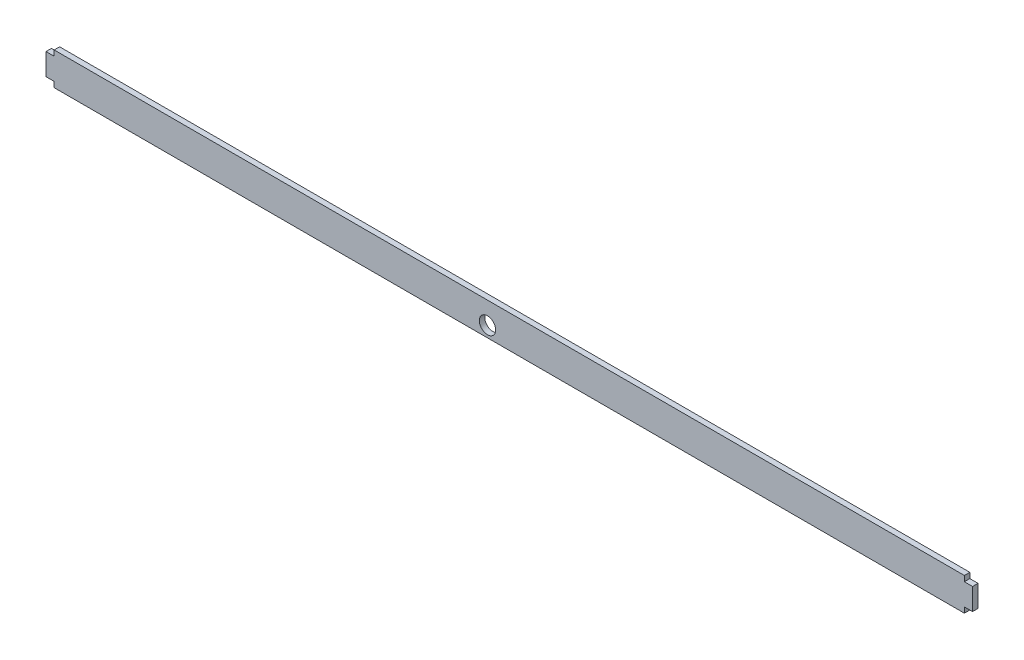
from build123d import *

# Parameters (mm, degrees)
BOSS_EXTRUDE1_DEPTH = 3.175
SKETCH2_R           = 4.7625
CUT_EXTRUDE1_DEPTH  = 536.33597701


with BuildPart() as part:
    # Sketch1 → Boss-Extrude1 (new body)
    with BuildSketch(Plane.XY):
        Polygon((530.225, 15.875), (530.225, 19.05), (0, 19.05), (0, 15.875), (-4.7625, 15.875), (-4.7625, 3.175), (0, 3.175), (0, 0), (530.225, 0), (530.225, 3.175), (534.9875, 3.175), (534.9875, 15.875), align=None)
    extrude(amount=BOSS_EXTRUDE1_DEPTH)

    # Sketch2 → Cut-Extrude1 (cut, through all)
    with BuildSketch(Plane.XY.offset(3.175)):
        with Locations((252.4125, 6.35)):
            Circle(SKETCH2_R)
    extrude(amount=-CUT_EXTRUDE1_DEPTH, mode=Mode.SUBTRACT)


solid = part.part
